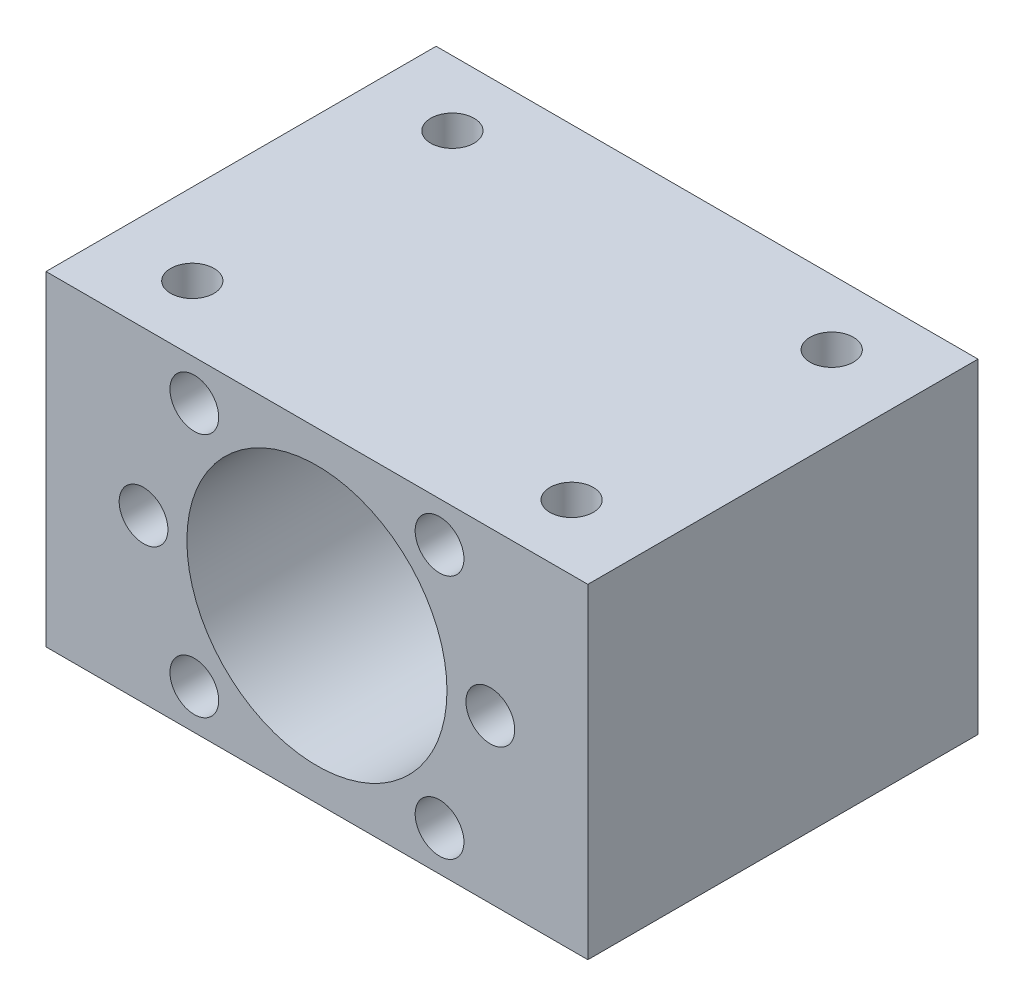
from build123d import *

# Parameters (mm, degrees)
SKETCH_1_W          = 50
SKETCH_1_H          = 30
SKETCH_1_R          = 2.25
SKETCH_1_R_2        = 12
EXTRUDE_1_DEPTH     = 36
SKETCH_2_R          = 2
CUT_EXTRUDE_1_DEPTH = 10.2


with BuildPart() as part:
    # 草图1 → 凸台-拉伸1 (new body)
    with BuildSketch(Plane.XY):
        Rectangle(SKETCH_1_W, SKETCH_1_H)
        with Locations((-11.313708499, 11.313708499)):
            Circle(SKETCH_1_R, mode=Mode.SUBTRACT)
        with Locations((-16, 0)):
            Circle(SKETCH_1_R, mode=Mode.SUBTRACT)
        with Locations((-11.313708499, -11.313708499)):
            Circle(SKETCH_1_R, mode=Mode.SUBTRACT)
        with Locations((11.313708499, -11.313708499)):
            Circle(SKETCH_1_R, mode=Mode.SUBTRACT)
        with Locations((16, 0)):
            Circle(SKETCH_1_R, mode=Mode.SUBTRACT)
        with Locations((11.313708499, 11.313708499)):
            Circle(SKETCH_1_R, mode=Mode.SUBTRACT)
        Circle(SKETCH_1_R_2, mode=Mode.SUBTRACT)
    extrude(amount=EXTRUDE_1_DEPTH)

    # 草图2 → 切除-拉伸1 (cut)
    with BuildSketch(Plane(origin=(0, 15, 0), x_dir=(1, 0, 0), z_dir=(0, 1, 0))):
        with Locations((17.5, -30)):
            Circle(SKETCH_2_R)
        with Locations((-17.5, -30)):
            Circle(SKETCH_2_R)
        with Locations((-17.5, -6)):
            Circle(SKETCH_2_R)
        with Locations((17.5, -6)):
            Circle(SKETCH_2_R)
    extrude(amount=-CUT_EXTRUDE_1_DEPTH, mode=Mode.SUBTRACT)


solid = part.part
